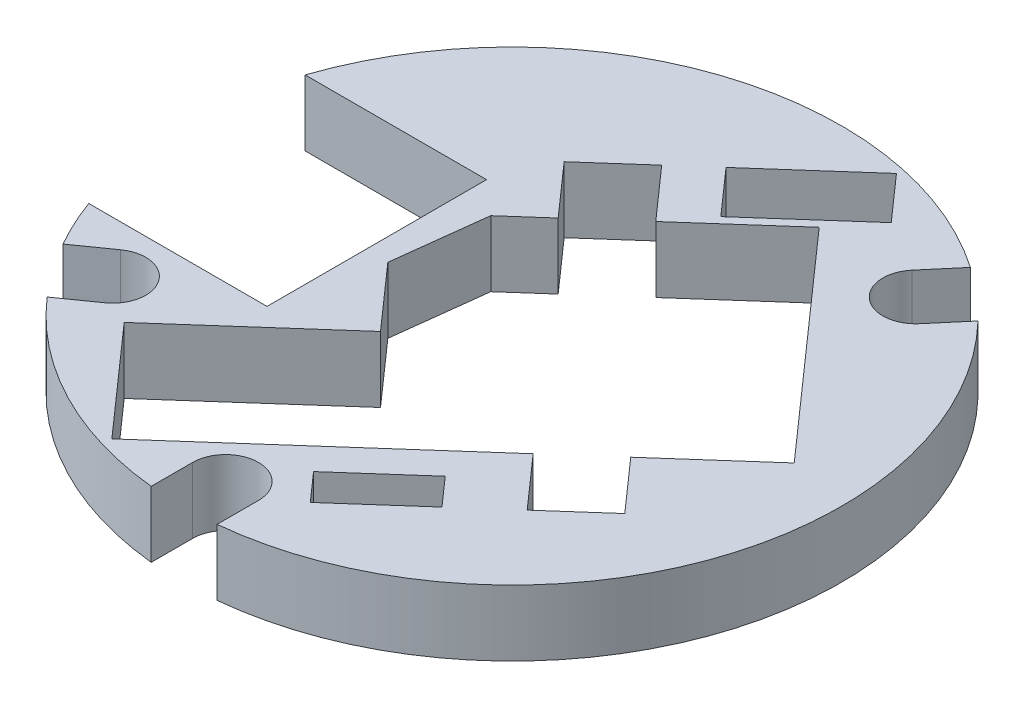
from build123d import *

# Parameters (mm, degrees)
SKETCH1_R           = 1.143
BOSS_EXTRUDE1_DEPTH = 1.524
SKETCH2_R           = 1.143
CUT_EXTRUDE1_DEPTH  = 25.96925768
SKETCH4_R           = 20.695463349
SKETCH4_R_2         = 15.2527
CUT_EXTRUDE2_DEPTH  = 25.96925768


with BuildPart() as part:
    # Sketch1 → Boss-Extrude1 (new, symmetric)
    with BuildSketch(Plane(origin=(0, 0, 0), x_dir=(1, 0, 0), z_dir=(0, 1, 0))):
        with BuildLine():
            Line((16.984058744, -5.5245), (16.984058744, 5.5245))
            ThreePointArc((16.984058744, 5.5245), (-0.338525345, 17.856756488), (-17.181244816, 4.8768))
            Line((-17.181244816, 4.8768), (-6.056265338, 4.8768))
            Line((-6.056265338, 4.8768), (-6.056265338, -5.2832))
            Line((-6.056265338, -5.2832), (-17.060660873, -5.2832))
            ThreePointArc((-17.060660873, -5.2832), (-0.126583546, -17.859516463), (16.984058744, -5.5245))
        make_face()
        with Locations((-10.832526773, -7.6454)):
            Circle(SKETCH1_R, mode=Mode.SUBTRACT)
        with Locations((0, -13.2588)):
            Circle(SKETCH1_R, mode=Mode.SUBTRACT)
        Polygon((2.802297432, -12.140610776), (1.641092014, -10.827900322), (4.875306175, -7.966959435), (6.036511594, -9.279669889), align=None, mode=Mode.SUBTRACT)
        Polygon((-4.338426069, -14.184340812), (-8.720293025, -9.230761998), (-2.425370717, -3.662361234), (-5.027565338, -0.720652536), (-4.515281158, 3.5306), (-2.860140414, 4.994714494), (-4.980602482, 7.391837931), (-2.583479045, 9.5123), (-0.463016976, 7.115176563), (3.551213542, 10.666109075), (12.420130291, 0.640045174), (8.405899773, -2.910887338), (10.526361842, -5.308010776), (8.129238404, -7.428472845), (6.008776335, -5.031349407), align=None, mode=Mode.SUBTRACT)
        Polygon((0.846775502, 8.816385505), (-1.004421543, 10.909112315), (3.181032078, 14.611506404), (5.032229122, 12.518779594), align=None, mode=Mode.SUBTRACT)
        with Locations((8.579035657, 10.1092)):
            Circle(SKETCH1_R, mode=Mode.SUBTRACT)
    extrude(amount=BOSS_EXTRUDE1_DEPTH, both=True)

    # Sketch2 → Cut-Extrude1 (cut, through all)
    # profile 1 of 3: a face of its own
    with BuildSketch(Plane(origin=(0, 1.524, 0), x_dir=(1, 0, 0), z_dir=(0, 1, 0))):
        with BuildLine():
            Line((1.524, -17.794824407), (1.524, -13.2588))
            ThreePointArc((1.524, -13.2588), (0, -11.7348), (-1.524, -13.2588))
            Line((-1.524, -13.2588), (-1.524, -17.794824407))
            ThreePointArc((-1.524, -17.794824407), (0, -17.859965052), (1.524, -17.794824407))
        make_face()
        with Locations((0, -13.2588)):
            Circle(SKETCH2_R, mode=Mode.SUBTRACT)
    # profile 2 of 3: a face of its own
    with BuildSketch(Plane(origin=(0, 1.524, 0), x_dir=(1, 0, 0), z_dir=(0, 1, 0))):
        with BuildLine():
            ThreePointArc((-15.417270145, -9.015882261), (-14.591708872, -10.298562224), (-13.659706927, -11.506118301))
            Line((-13.659706927, -11.506118301), (-9.953745163, -8.89051802))
            ThreePointArc((-9.953745163, -8.89051802), (-9.587408753, -6.766618391), (-11.711308382, -6.40028198))
            Line((-11.711308382, -6.40028198), (-15.417270145, -9.015882261))
        make_face()
        with Locations((-10.832526773, -7.6454)):
            Circle(SKETCH2_R, mode=Mode.SUBTRACT)
    # profile 3 of 3: a face of its own
    with BuildSketch(Plane(origin=(0, 1.524, 0), x_dir=(1, 0, 0), z_dir=(0, 1, 0))):
        with BuildLine():
            Line((10.352068988, 14.55379742), (7.417058645, 11.095296053))
            ThreePointArc((7.417058645, 11.095296053), (7.592939604, 8.947222989), (9.741012668, 9.123103947))
            Line((9.741012668, 9.123103947), (12.676023011, 12.581605315))
            ThreePointArc((12.676023011, 12.581605315), (11.556194906, 13.61736799), (10.352068988, 14.55379742))
        make_face()
        with Locations((8.579035657, 10.1092)):
            Circle(SKETCH2_R, mode=Mode.SUBTRACT)
    extrude(amount=-CUT_EXTRUDE1_DEPTH, mode=Mode.SUBTRACT)

    # Sketch4 → Cut-Extrude2 (cut, through all)
    with BuildSketch(Plane(origin=(0, 1.524, 0), x_dir=(1, 0, 0), z_dir=(0, 1, 0))):
        Circle(SKETCH4_R)
        Circle(SKETCH4_R_2, mode=Mode.SUBTRACT)
    extrude(amount=-CUT_EXTRUDE2_DEPTH, mode=Mode.SUBTRACT)


solid = part.part
